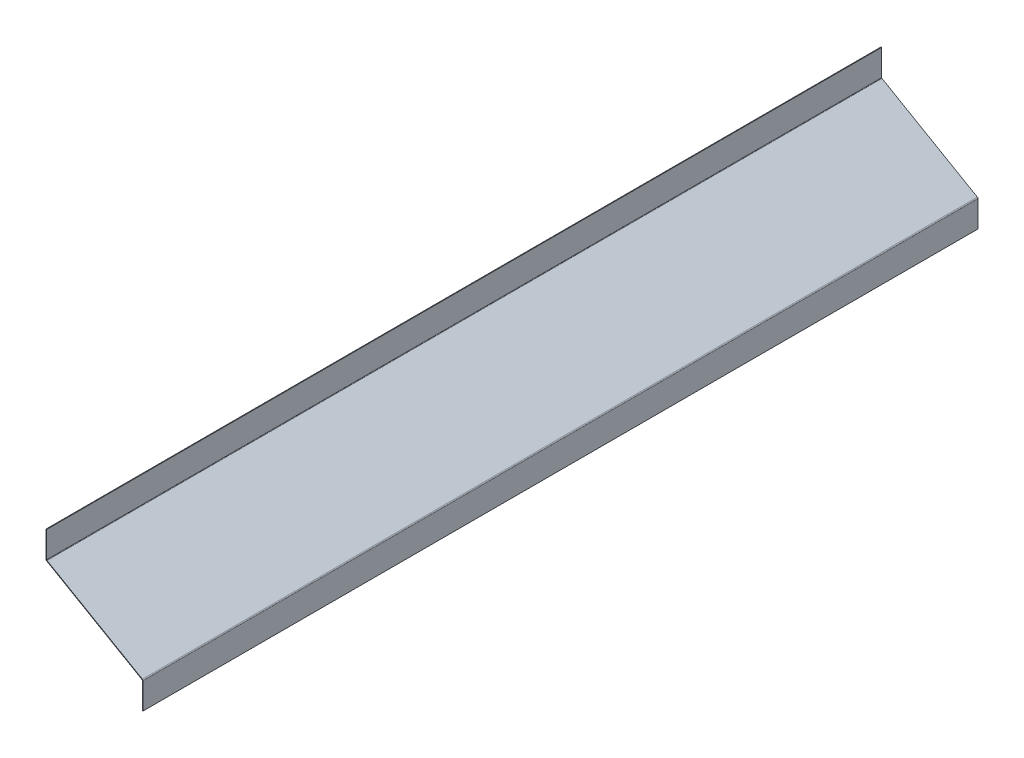
from build123d import *

# Parameters (mm, degrees)
BASE_FLANGE1_DEPTH = 1242


# Sheet-metal steps are written as plain solids
with BuildPart() as part:
    # Sketch1 → Base-Flange1 (new body)
    with BuildSketch(Plane.XY):
        with BuildLine():
            Line((0, 39.5), (0, 0.577350269))
            ThreePointArc((0, 0.577350269), (0.133974596, 0.077350269), (0.5, -0.288675135))
            Line((0.5, -0.288675135), (142.327204326, -82.172649731))
            ThreePointArc((142.327204326, -82.172649731), (143.059255134, -82.904700538), (143.327204326, -83.904700538))
            Line((143.327204326, -83.904700538), (143.327204326, -122.78))
            Line((143.327204326, -122.78), (142.327204326, -122.78))
            Line((142.327204326, -122.78), (142.327204326, -83.904700538))
            ThreePointArc((142.327204326, -83.904700538), (142.19322973, -83.404700538), (141.827204326, -83.038675135))
            Line((141.827204326, -83.038675135), (0, -1.154700538))
            ThreePointArc((0, -1.154700538), (-0.732050808, -0.422649731), (-1, 0.577350269))
            Line((-1, 0.577350269), (-1, 39.5))
            Line((-1, 39.5), (0, 39.5))
        make_face()
    extrude(amount=BASE_FLANGE1_DEPTH)


solid = part.part
